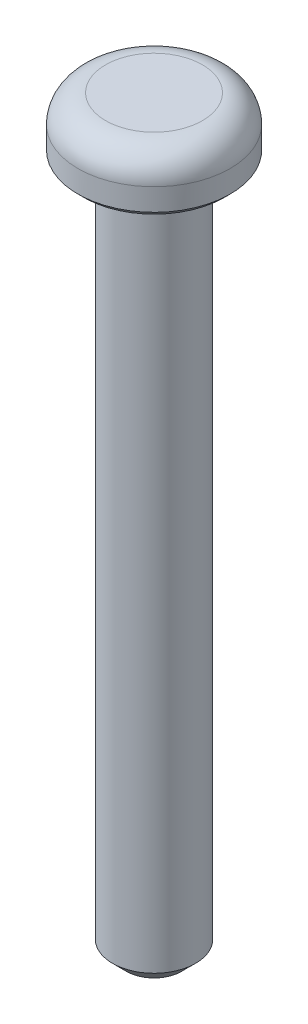
from build123d import *

# Parameters (mm, degrees)
FILLET1_R     = 1
CHAMFER1_SIZE = 0.5
CHAMFER2_SIZE = 0.2


with BuildPart() as part:
    # Sketch1 → Revolve1 (revolve)
    with BuildSketch(Plane.XY):
        Polygon((0, 0), (0, 27), (2.75, 27), (2.75, 25), (1.5, 25), (1.5, 0), align=None)
    revolve(axis=Axis((0, 0, 0), (0, 1, 0)))

    # Fillet1
    fillet1_edges = [part.edges().sort_by_distance(p)[0] for p in [
        (-2.75, 27, 0),
    ]]
    fillet(fillet1_edges, radius=FILLET1_R)

    # Chamfer1
    chamfer1_edges = [part.edges().sort_by_distance(p)[0] for p in [
        (-1.5, 0, 0),
    ]]
    chamfer(chamfer1_edges, length=CHAMFER1_SIZE)

    # Chamfer2
    chamfer2_edges = [part.edges().sort_by_distance(p)[0] for p in [
        (-2.75, 25, 0),
    ]]
    chamfer(chamfer2_edges, length=CHAMFER2_SIZE)


solid = part.part
